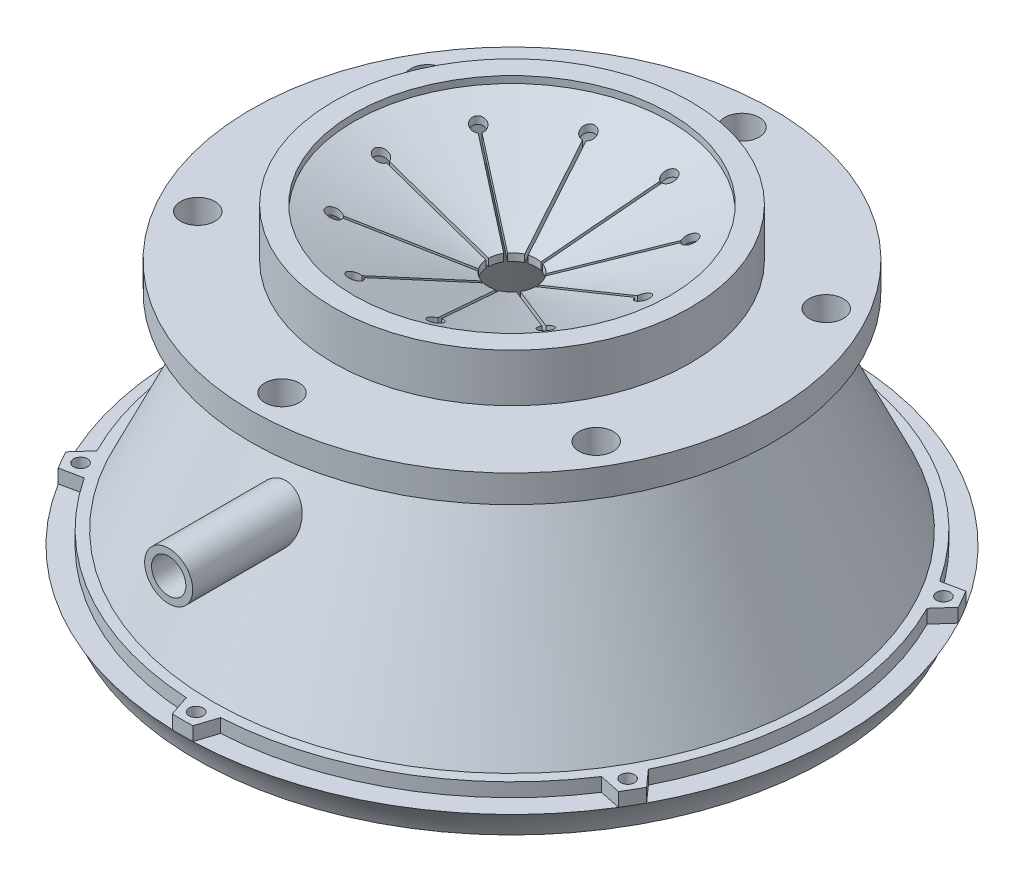
from build123d import *

# Parameters (mm, degrees)
SKETCH2_R               = 51.435
BOSS_EXTRUDE1_DEPTH     = 2.54
SKETCH4_R               = 48.26
SKETCH4_R_2             = 29.21
BOSS_EXTRUDE2_DEPTH     = 5.08
SKETCH7_R               = 33.02
SKETCH7_R_2             = 29.21
BOSS_EXTRUDE3_DEPTH     = 8.89
CUT_EXTRUDE2_START      = -13.9700001
CUT_EXTRUDE2_DEPTH      = 10.974698256
SKETCH10_R              = 1.285113885
CUT_EXTRUDE3_DEPTH      = 2.54
CIRPATTERN1_COUNT       = 6
BOSS_EXTRUDE4_REACH     = 152.895
SKETCH11_R              = 4.445
SKETCH12_R              = 3.175
CUT_EXTRUDE4_DEPTH      = 25.4
CUT_EXTRUDE5_DEPTH      = 102.631745103
CUT_EXTRUDE5_DEPTH_BACK = 5.08
SKETCH13_R              = 3.175


# Read off the part's stored shape, not the designer's step: Cut-Extrude2
with BuildPart() as part:
    # Sketch1 → Revolve1 (revolve)
    with BuildSketch(Plane.XY, mode=Mode.PRIVATE) as revolve1_sk:
        with BuildLine():
            Line((60.96, 5.08), (53.34, 5.08))
            Line((53.34, 5.08), (53.34, 0))
            Line((53.34, 0), (58.42, 0))
            ThreePointArc((58.42, 0), (59.483398793, 2.643300604), (60.96, 5.08))
        make_face()
    revolve(revolve1_sk.sketch.rotate(Axis((0, 0, 0), (0, 1, 0)), 90), axis=Axis((0, 0, 0), (0, 1, 0)))

    # Sketch2 → Boss-Extrude1 (add)
    with BuildSketch(Plane(origin=(0, 5.08, 0), x_dir=(1, 0, 0), z_dir=(0, 1, 0))):
        with BuildLine():
            Line((-1.905, 60.930227104), (-3.175, 57.061737399))
            ThreePointArc((-3.175, 57.061737399), (-28.575, 49.493351826), (-47.829414172, 31.280499357))
            Line((-47.829414172, 31.280499357), (-51.814624531, 32.114891946))
            ThreePointArc((-51.814624531, 32.114891946), (-52.792908615, 30.48), (-53.719624531, 28.815335158))
            Line((-53.719624531, 28.815335158), (-51.004414172, 25.781238043))
            ThreePointArc((-51.004414172, 25.781238043), (-57.15, 0), (-51.004414172, -25.781238043))
            Line((-51.004414172, -25.781238043), (-53.719624531, -28.815335158))
            ThreePointArc((-53.719624531, -28.815335158), (-52.792908615, -30.48), (-51.814624531, -32.114891946))
            Line((-51.814624531, -32.114891946), (-47.829414172, -31.280499357))
            ThreePointArc((-47.829414172, -31.280499357), (-28.575, -49.493351826), (-3.175, -57.061737399))
            Line((-3.175, -57.061737399), (-1.905, -60.930227104))
            ThreePointArc((-1.905, -60.930227104), (0, -60.96), (1.905, -60.930227104))
            Line((1.905, -60.930227104), (3.175, -57.061737399))
            ThreePointArc((3.175, -57.061737399), (28.575, -49.493351826), (47.829414172, -31.280499357))
            Line((47.829414172, -31.280499357), (51.814624531, -32.114891946))
            ThreePointArc((51.814624531, -32.114891946), (52.792908615, -30.48), (53.719624531, -28.815335158))
            Line((53.719624531, -28.815335158), (51.004414172, -25.781238043))
            ThreePointArc((51.004414172, -25.781238043), (57.15, 0), (51.004414172, 25.781238043))
            Line((51.004414172, 25.781238043), (53.719624531, 28.815335158))
            ThreePointArc((53.719624531, 28.815335158), (52.792908615, 30.48), (51.814624531, 32.114891946))
            Line((51.814624531, 32.114891946), (47.829414172, 31.280499357))
            ThreePointArc((47.829414172, 31.280499357), (28.575, 49.493351826), (3.175, 57.061737399))
            Line((3.175, 57.061737399), (1.905, 60.930227104))
            ThreePointArc((1.905, 60.930227104), (0, 60.96), (-1.905, 60.930227104))
        make_face()
        with Locations(Location((0, 0, 0), (0, 0, 270))):
            Circle(SKETCH2_R, mode=Mode.SUBTRACT)
    extrude(amount=BOSS_EXTRUDE1_DEPTH)

    # Sketch3 → Revolve2 (revolve)
    with BuildSketch(Plane.XY, mode=Mode.PRIVATE) as revolve2_sk:
        Polygon((-51.435, 7.62), (-33.668678224, 45.72), (-37.478678224, 45.72), (-55.245, 7.62), align=None)
    revolve(revolve2_sk.sketch.rotate(Axis((0, 45.72, 0), (0, 1, 0)), 90), axis=Axis((0, 45.72, 0), (0, 1, 0)))

    # Sketch4 → Boss-Extrude2 (add)
    with BuildSketch(Plane(origin=(0, 45.72, 0), x_dir=(1, 0, 0), z_dir=(0, 1, 0))):
        with Locations(Location((0, 0, 0), (0, 0, 270))):
            Circle(SKETCH4_R)
        with Locations(Location((0, 0, 0), (0, 0, 270))):
            Circle(SKETCH4_R_2, mode=Mode.SUBTRACT)
    extrude(amount=BOSS_EXTRUDE2_DEPTH)

    # Sketch7 → Boss-Extrude3 (add)
    with BuildSketch(Plane(origin=(0, 50.8, 0), x_dir=(1, 0, 0), z_dir=(0, 1, 0))):
        with Locations(Location((0, 0, 0), (0, 0, 270))):
            Circle(SKETCH7_R)
        with Locations(Location((0, 0, 0), (0, 0, 270))):
            Circle(SKETCH7_R_2, mode=Mode.SUBTRACT)
    extrude(amount=BOSS_EXTRUDE3_DEPTH)

    # Sketch8 → Revolve3 (revolve)
    with BuildSketch(Plane.XY, mode=Mode.PRIVATE) as revolve3_sk:
        Polygon((0, 47.082311557), (29.21, 58.42), (29.21, 57.057688443), (0, 45.72), align=None)
    revolve(revolve3_sk.sketch.rotate(Axis((0, 50.8, 0), (0, -1, 0)), 90), axis=Axis((0, 50.8, 0), (0, -1, 0)))

    # Cut-Extrude2 outline → Cut-Extrude2 (cut)
    with BuildSketch(Plane(origin=(0, 59.69, 0), x_dir=(1, 0, 0), z_dir=(0, 1, 0)).offset(CUT_EXTRUDE2_START)):
        with BuildLine():
            ThreePointArc((-0.994569109, -4.339743459), (0.141521891, -4.450001411), (1.2683112, -4.267777841))
            Line((1.2683112, -4.267777841), (7.306062216, -21.018511035))
            ThreePointArc((7.306062216, -21.018511035), (8.397605671, -23.297756201), (7.783964777, -20.84625248))
            Line((7.783964777, -20.84625248), (1.746213892, -4.095519264))
            ThreePointArc((1.746213892, -4.095519264), (2.730138817, -3.516942286), (3.53462219, -2.707210183))
            Line((3.53462219, -2.707210183), (18.26509934, -12.70993692))
            ThreePointArc((18.26509934, -12.70993692), (20.487883195, -13.912291948), (18.550479529, -12.289672857))
            Line((18.550479529, -12.289672857), (3.820002538, -2.286945912))
            ThreePointArc((3.820002538, -2.286945912), (4.275935508, -1.240530744), (4.450827641, -0.112580249))
            Line((4.450827641, -0.112580249), (22.247489269, 0.453400975))
            ThreePointArc((22.247489269, 0.453400975), (24.752485716, 0.787194932), (22.231341683, 0.961144263))
            Line((22.231341683, 0.961144263), (4.434680052, 0.395163048))
            ThreePointArc((4.434680052, 0.395163048), (4.18847017, 1.509721378), (3.666968211, 2.525051513))
            Line((3.666968211, 2.525051513), (17.732094251, 13.443555396))
            ThreePointArc((17.732094251, 13.443555396), (19.562480099, 15.186000045), (17.420586839, 13.844836755))
            Line((17.420586839, 13.844836755), (3.355460515, 2.926333154))
            ThreePointArc((3.355460515, 2.926333154), (2.501151587, 3.683311247), (1.48245156, 4.19819942))
            Line((1.48245156, 4.19819942), (6.443642218, 21.298728255))
            ThreePointArc((6.443642218, 21.298728255), (6.900271883, 23.784269443), (5.955759934, 21.440272253))
            Line((5.955759934, 21.440272253), (0.994569109, 4.339743459))
            ThreePointArc((0.994569109, 4.339743459), (-0.141521891, 4.450001411), (-1.2683112, 4.267777841))
            Line((-1.2683112, 4.267777841), (-7.306062277, 21.018510998))
            ThreePointArc((-7.306062277, 21.018510998), (-8.397605645, 23.29775621), (-7.783964763, 20.846252482))
            Line((-7.783964763, 20.846252482), (-1.746213892, 4.095519264))
            ThreePointArc((-1.746213892, 4.095519264), (-2.730138817, 3.516942286), (-3.53462219, 2.707210183))
            Line((-3.53462219, 2.707210183), (-18.265099344, 12.709936911))
            ThreePointArc((-18.265099344, 12.709936911), (-20.487883192, 13.91229195), (-18.550479529, 12.289672857))
            Line((-18.550479529, 12.289672857), (-3.820002538, 2.286945912))
            ThreePointArc((-3.820002538, 2.286945912), (-4.275935508, 1.240530744), (-4.450827641, 0.112580249))
            Line((-4.450827641, 0.112580249), (-22.247489269, -0.453400975))
            ThreePointArc((-22.247489269, -0.453400975), (-24.752485716, -0.787194932), (-22.231341683, -0.961144263))
            Line((-22.231341683, -0.961144263), (-4.434680052, -0.395163048))
            ThreePointArc((-4.434680052, -0.395163048), (-4.18847017, -1.509721378), (-3.666968211, -2.525051513))
            Line((-3.666968211, -2.525051513), (-17.732094308, -13.443555347))
            ThreePointArc((-17.732094308, -13.443555347), (-19.562480051, -15.186000107), (-17.420586877, -13.844836679))
            Line((-17.420586877, -13.844836679), (-3.355460515, -2.926333154))
            ThreePointArc((-3.355460515, -2.926333154), (-2.501151587, -3.683311247), (-1.48245156, -4.19819942))
            Line((-1.48245156, -4.19819942), (-6.443642178, -21.298728258))
            ThreePointArc((-6.443642178, -21.298728258), (-6.900271889, -23.784269441), (-5.955759961, -21.440272239))
            Line((-5.955759961, -21.440272239), (-0.994569109, -4.339743459))
        make_face()
    extrude(amount=CUT_EXTRUDE2_DEPTH, mode=Mode.SUBTRACT)

    # Sketch10 → Cut-Extrude3 (cut)
    with BuildSketch(Plane(origin=(0, 7.62, 0), x_dir=(1, 0, 0), z_dir=(0, 1, 0))):
        with Locations(Location((0, 58.42, 0), (0, 0, 270))):
            Circle(SKETCH10_R)
    cut_extrude3 = extrude(amount=-CUT_EXTRUDE3_DEPTH, mode=Mode.SUBTRACT)

    # CirPattern1: Cut-Extrude3 ×6 about axis
    cirpattern1_axis = Axis((0, 0, 0), (0, 1, 0))
    for i in range(1, CIRPATTERN1_COUNT):
        add(cut_extrude3.rotate(cirpattern1_axis, i * 360 / CIRPATTERN1_COUNT), mode=Mode.SUBTRACT)

    # Sketch11 → Boss-Extrude4 (add, up to next)
    with BuildSketch(Plane.XY.offset(63.5), mode=Mode.PRIVATE) as boss_extrude4_sk1:
        with Locations((0, 31.932164591)):
            Circle(SKETCH11_R)
    boss_extrude4_tool1 = extrude(boss_extrude4_sk1.sketch, amount=-BOSS_EXTRUDE4_REACH, mode=Mode.PRIVATE) - part.part
    add(boss_extrude4_tool1.solids().sort_by_distance((0, 31.932165, 63.5))[0])

    # Sketch12 → Cut-Extrude4 (cut)
    with BuildSketch(Plane.XY.offset(63.5)):
        with Locations((0, 31.932164591)):
            Circle(SKETCH12_R)
    extrude(amount=-CUT_EXTRUDE4_DEPTH, mode=Mode.SUBTRACT)

    # Sketch13 → Cut-Extrude5 (cut, two sides: drawn at the far end of the back side and taken through both)
    with BuildSketch(Plane(origin=(0, 50.8, 0), x_dir=(1, 0, 0), z_dir=(0, 1, 0)).offset(-CUT_EXTRUDE5_DEPTH_BACK)):
        with Locations(Location((0, 42.545, 0), (0, 0, 270))):
            Circle(SKETCH13_R)
        with Locations(Location((36.845050804, 21.2725, 0), (0, 0, 270))):
            Circle(SKETCH13_R)
        with Locations(Location((36.845050804, -21.2725, 0), (0, 0, 270))):
            Circle(SKETCH13_R)
        with Locations(Location((0, -42.545, 0), (0, 0, 270))):
            Circle(SKETCH13_R)
        with Locations(Location((-36.845050804, -21.2725, 0), (0, 0, 270))):
            Circle(SKETCH13_R)
        with Locations(Location((-36.845050804, 21.2725, 0), (0, 0, 270))):
            Circle(SKETCH13_R)
    extrude(amount=CUT_EXTRUDE5_DEPTH + CUT_EXTRUDE5_DEPTH_BACK, mode=Mode.SUBTRACT)


solid = part.part
